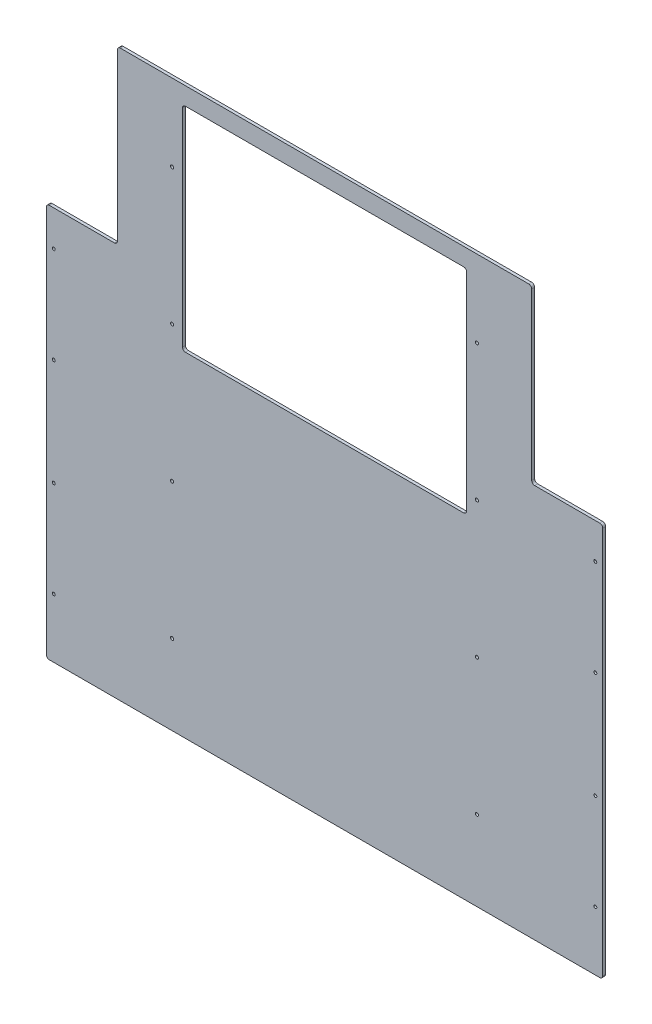
from build123d import *

# Parameters (mm, degrees)
SKETCH1_W                   = 1193.8
SKETCH1_H                   = 1212.85
BOSS_EXTRUDE1_DEPTH         = 6.35
SKETCH2_W                   = 609.6
SKETCH2_H                   = 457.2
CUT_EXTRUDE1_DEPTH          = 1702.823693865
SKETCH3_W                   = 152.4
SKETCH3_H                   = 330.2
CUT_EXTRUDE2_DEPTH          = 1702.823693865
F_1_4_0_25_DIAMETER_HOLE1_D = 6.35
F_1_4_CLEARANCE_HOLE1_D     = 6.7564
SKETCH8_W                   = 152.4
SKETCH8_H                   = 38.1
CUT_EXTRUDE3_DEPTH          = 1702.823693865
FILLET1_R                   = 6.35


with BuildPart() as part:
    # Sketch1 → Boss-Extrude1 (new body)
    with BuildSketch(Plane.XY):
        with Locations((596.9, 606.425)):
            Rectangle(SKETCH1_W, SKETCH1_H)
    extrude(amount=BOSS_EXTRUDE1_DEPTH)

    # Sketch2 → Cut-Extrude1 (cut, through all)
    with BuildSketch(Plane.XY.offset(6.35)):
        with Locations((596.9, 946.15)):
            Rectangle(SKETCH2_W, SKETCH2_H)
    extrude(amount=-CUT_EXTRUDE1_DEPTH, mode=Mode.SUBTRACT)

    # Sketch3 → Cut-Extrude2 (cut, through all)
    with BuildSketch(Plane.XY.offset(6.35)):
        with Locations((76.2, 1009.65)):
            Rectangle(SKETCH3_W, SKETCH3_H)
        with Locations((1117.6, 1009.65)):
            Rectangle(SKETCH3_W, SKETCH3_H)
    extrude(amount=-CUT_EXTRUDE2_DEPTH, mode=Mode.SUBTRACT)

    # 1/4 (0.25) Diameter Hole1 (through all)
    with Locations(Plane.XY.offset(6.35)):
        with Locations((15.875, 127), (15.875, 333.375), (15.875, 561.975), (15.875, 768.35), (1177.925, 768.35), (1177.925, 561.975), (1177.925, 333.375), (1177.925, 127)):
            Hole(F_1_4_0_25_DIAMETER_HOLE1_D / 2)

    # 1/4 Clearance Hole1 (through all)
    with Locations(Plane.XY.offset(6.35)):
        with Locations((923.925, 1047.75), (269.875, 1047.75), (269.875, 755.65), (269.875, 463.55), (269.875, 171.45), (923.925, 171.45), (923.925, 463.55), (923.925, 755.65)):
            Hole(F_1_4_CLEARANCE_HOLE1_D / 2)

    # Sketch8 → Cut-Extrude3 (cut, through all)
    with BuildSketch(Plane.XY.offset(6.35)):
        with Locations((76.2, 1193.8)):
            Rectangle(SKETCH8_W, SKETCH8_H)
        with Locations((1117.6, 1193.8)):
            Rectangle(SKETCH8_W, SKETCH8_H)
    extrude(amount=-CUT_EXTRUDE3_DEPTH, mode=Mode.SUBTRACT)

    # Fillet1
    fillet1_edges = [part.edges().sort_by_distance(p)[0] for p in [
        (901.7, 1174.75, 3.175),
        (901.7, 717.55, 3.175),
        (292.1, 717.55, 3.175),
        (152.4, 844.55, 3.175),
        (0, 844.55, 3.175),
        (0, 0, 3.175),
        (1193.8, 0, 3.175),
        (1193.8, 844.55, 3.175),
        (1041.4, 844.55, 3.175),
        (1041.4, 1212.85, 3.175),
        (152.4, 1212.85, 3.175),
        (292.1, 1174.75, 3.175),
    ]]
    fillet(fillet1_edges, radius=FILLET1_R)


solid = part.part
